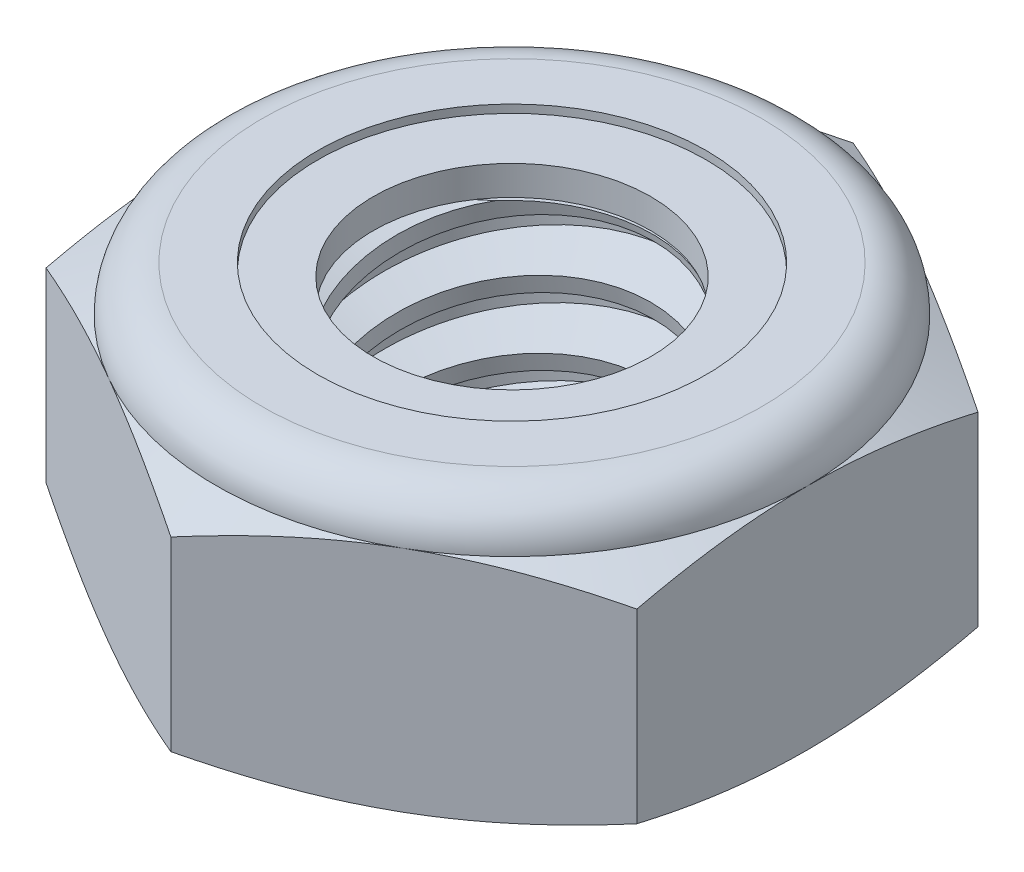
from build123d import *

# Parameters (mm, degrees)
EXTRUDE1_DEPTH       = 5.159375
SKETCH2_W            = 3.175
SKETCH2_H            = 5.159375
LPATTERN1_COUNT      = 4
LPATTERN1_PITCH      = 1.27
LPATTERN1_COUNT_DIR2 = 2
LPATTERN1_PITCH_DIR2 = 1.27


with BuildPart() as part:
    # Sketch1 → Extrude1 (new body)
    with BuildSketch(Plane(origin=(0, 0, 0), x_dir=(1, 0, 0), z_dir=(0, 1, 0))):
        Polygon((0, 6.415804866), (-5.55625, 3.207902433), (-5.55625, -3.207902433), (0, -6.415804866), (5.55625, -3.207902433), (5.55625, 3.207902433), align=None)
    extrude(amount=EXTRUDE1_DEPTH)

    # Sketch4 → Cut-Revolve2 (revolve, cut)
    with BuildSketch(Plane(origin=(0, 0, 0), x_dir=(0, 0, -1), z_dir=(1, 0, 0))):
        Polygon((0, 5.159375), (3.175, 5.159375), (2.609908356, 4.895868439), (2.609908356, 0.263506561), (3.175, 0), (0, 0), align=None)
    revolve(axis=Axis((0, 5.159375, 0), (0, 1, 0)), mode=Mode.SUBTRACT)


with BuildPart() as body_2:
    # Sketch2 → Revolve1 (revolve)
    with BuildSketch(Plane(origin=(0, 0, 0), x_dir=(0, 0, -1), z_dir=(1, 0, 0))):
        with Locations((1.5875, 2.5796875)):
            Rectangle(SKETCH2_W, SKETCH2_H)
    revolve(axis=Axis((0, -3.175, 0), (0, 1, 0)))

    # Sketch3 → Cut-Revolve1 (revolve, cut)
    with BuildSketch(Plane(origin=(0, 0, 0), x_dir=(0, 0, -1), z_dir=(1, 0, 0))):
        Polygon((3.206133436, 5.003707818), (3.424067492, 3.914037542), (2.672175229, 4.168393763), (2.609908356, 4.479728128), align=None)
    cut_revolve1 = revolve(axis=Axis((0, 5.159375, 0.272704483), (0, -0.9805806756909202, -0.1961161351381843)), mode=Mode.SUBTRACT)

    # LPattern1: Cut-Revolve1 4 × 2
    with Locations(*[Vector(0, -1, 0) * (i * LPATTERN1_PITCH) + Vector(0, 1, 0) * (j * LPATTERN1_PITCH_DIR2) for i in range(LPATTERN1_COUNT) for j in range(LPATTERN1_COUNT_DIR2) if (i, j) != (0, 0)]):
        add(cut_revolve1, mode=Mode.SUBTRACT)


with BuildPart() as part_1:
    add(part.part)

    # Combine1: cut body 2
    add(body_2.part, mode=Mode.SUBTRACT)

    # Sketch5 → Cut-Revolve3 (revolve, cut)
    with BuildSketch(Plane(origin=(0, 0, 0), x_dir=(0, 0, -1), z_dir=(1, 0, 0))):
        with BuildLine():
            Line((0, 0), (5.55625, 0))
            Line((5.55625, 0), (6.415804866, 0.400817017))
            Line((6.415804866, 0.400817017), (6.415804866, 3.89866215))
            Line((6.415804866, 3.89866215), (5.55625, 4.299479167))
            ThreePointArc((5.55625, 4.299479167), (5.304392342, 4.907517342), (4.696354167, 5.159375))
            Line((4.696354167, 5.159375), (4.696354167, 6.429375))
            Line((4.696354167, 6.429375), (7.685804866, 6.429375))
            Line((7.685804866, 6.429375), (7.685804866, -1.27))
            Line((7.685804866, -1.27), (0, -1.27))
            Line((0, -1.27), (0, 0))
        make_face()
    revolve(axis=Axis((0, 0, 0), (0, 1, 0)), mode=Mode.SUBTRACT)

    # Sketch6 → Cut-Revolve4 (revolve, cut)
    with BuildSketch(Plane(origin=(0, 0, 0), x_dir=(0, 0, -1), z_dir=(1, 0, 0))):
        with BuildLine():
            Line((0, 4.299479167), (5.40385, 4.299479167))
            ThreePointArc((5.40385, 4.299479167), (5.196629268, 4.799754268), (4.696354167, 5.006975))
            Line((4.696354167, 5.006975), (3.653131261, 5.006975))
            Line((3.653131261, 5.006975), (3.653131261, 6.429375))
            Line((3.653131261, 6.429375), (0, 6.429375))
            Line((0, 6.429375), (0, 4.299479167))
        make_face()
    revolve(axis=Axis((0, 6.429375, 0), (0, 1, 0)), mode=Mode.SUBTRACT)


with BuildPart() as body_2_2:
    # Sketch7 → Revolve2 (revolve)
    with BuildSketch(Plane(origin=(0, 0, 0), x_dir=(0, 0, -1), z_dir=(1, 0, 0))):
        with BuildLine():
            Line((2.609908356, 4.375679167), (5.3230343, 4.375679167))
            ThreePointArc((5.3230343, 4.375679167), (5.114940888, 4.772046184), (4.696354167, 4.930775))
            Line((4.696354167, 4.930775), (2.609908356, 4.930775))
            Line((2.609908356, 4.930775), (2.609908356, 4.375679167))
        make_face()
    revolve(axis=Axis((0, 4.375679167, 0), (0, 1, 0)))


solid = Compound([part_1.part, body_2_2.part])
